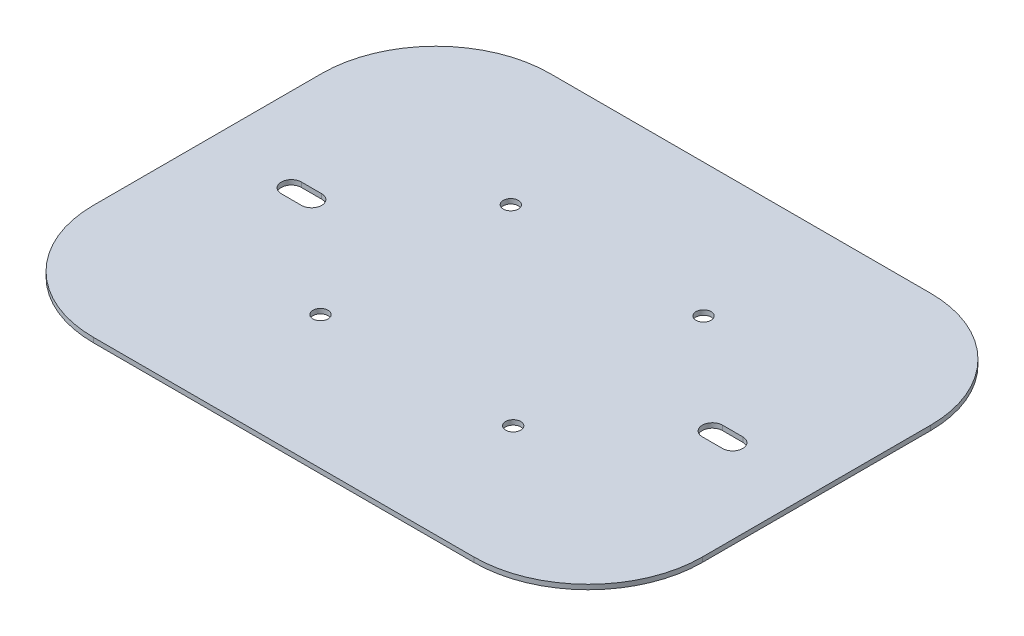
from build123d import *

# Parameters (mm, degrees)
BOSS_EXTRUDE1_DEPTH         = 3.175
F_1_2_CLEARANCE_SLOT1_DEPTH = 3.175
F_3_8_CLEARANCE_HOLE1_D     = 10.0838


# Read off the part's stored shape, not the designer's step: 1/2 Clearance Slot1
with BuildPart() as part:
    # Sketch1 → Boss-Extrude1 (new body)
    with BuildSketch(Plane(origin=(0, 0, 0), x_dir=(1, 0, 0), z_dir=(0, 1, 0))):
        with BuildLine():
            Line((76.2, 0), (330.2, 0))
            ThreePointArc((330.2, 0), (384.081536726, 22.318463274), (406.4, 76.2))
            Line((406.4, 76.2), (406.4, 228.6))
            ThreePointArc((406.4, 228.6), (384.081536726, 282.481536726), (330.2, 304.8))
            Line((330.2, 304.8), (76.2, 304.8))
            ThreePointArc((76.2, 304.8), (22.318463274, 282.481536726), (0, 228.6))
            Line((0, 228.6), (0, 76.2))
            ThreePointArc((0, 76.2), (22.318463274, 22.318463274), (76.2, 0))
        make_face()
    extrude(amount=BOSS_EXTRUDE1_DEPTH)

    # 1/2 Clearance Slot1 outline → 1/2 Clearance Slot1 (cut)
    with BuildSketch(Plane(origin=(0, 0, 0), x_dir=(1, 0, 0), z_dir=(0, 1, 0))):
        with BuildLine():
            Line((336.94624, 145.65376), (350.44126, 145.65376))
            ThreePointArc((350.44126, 145.65376), (357.1875, 152.4), (350.44126, 159.14624))
            Line((350.44126, 159.14624), (336.94624, 159.14624))
            ThreePointArc((336.94624, 159.14624), (330.2, 152.4), (336.94624, 145.65376))
        make_face()
        with BuildLine():
            ThreePointArc((69.45376, 145.65376), (76.2, 152.4), (69.45376, 159.14624))
            Line((69.45376, 159.14624), (55.95874, 159.14624))
            ThreePointArc((55.95874, 159.14624), (49.2125, 152.4), (55.95874, 145.65376))
            Line((55.95874, 145.65376), (69.45376, 145.65376))
        make_face()
    extrude(amount=F_1_2_CLEARANCE_SLOT1_DEPTH, mode=Mode.SUBTRACT)

    # 3/8 Clearance Hole1 (through all)
    with Locations(Plane(origin=(0, 3.175, 0), x_dir=(1, 0, 0), z_dir=(0, 1, 0))):
        with Locations((138.90625, 88.9), (267.49375, 215.9), (267.49375, 88.9), (138.90625, 215.9)):
            Hole(F_3_8_CLEARANCE_HOLE1_D / 2)


solid = part.part
